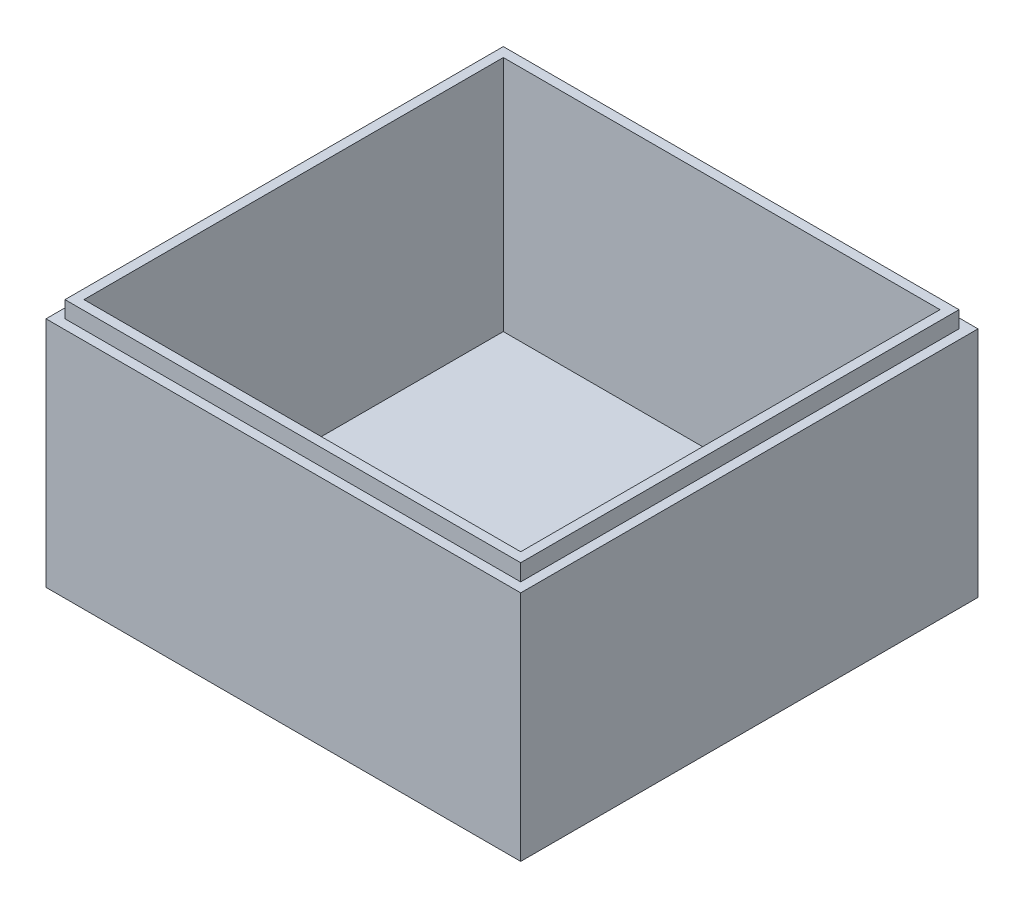
from build123d import *

# Parameters (mm, degrees)
BATTERYANDOUTERWALLS_W   = 60
BATTERYANDOUTERWALLS_H   = 57.8
BATTERYANDOUTERWALLS_W_2 = 55.2
BATTERYANDOUTERWALLS_H_2 = 53
WALLS_DEPTH              = 30
SKETCH2_W                = 60
SKETCH2_H                = 57.8
BOTTOM_DEPTH             = 1.5
SINKRIM_W                = 60
SINKRIM_H                = 57.8
SINKRIM_W_2              = 57.6
SINKRIM_H_2              = 55.4
TOP_CUT_DEPTH            = 2.1
BOSS_EXTRUDE2_DEPTH      = 60


with BuildPart() as part:
    # BatteryAndOuterWalls → Walls (new body)
    with BuildSketch(Plane(origin=(0, 0, 0), x_dir=(1, 0, 0), z_dir=(0, 1, 0))):
        Rectangle(BATTERYANDOUTERWALLS_W, BATTERYANDOUTERWALLS_H)
        Rectangle(BATTERYANDOUTERWALLS_W_2, BATTERYANDOUTERWALLS_H_2, mode=Mode.SUBTRACT)
    extrude(amount=WALLS_DEPTH)

    # Sketch2 → Bottom (add)
    with BuildSketch(Plane.XZ):
        Rectangle(SKETCH2_W, SKETCH2_H)
    extrude(amount=BOTTOM_DEPTH)

    # SinkRim → Top-Cut (cut)
    with BuildSketch(Plane(origin=(0, 30, 0), x_dir=(1, 0, 0), z_dir=(0, 1, 0))):
        Rectangle(SINKRIM_W, SINKRIM_H)
        Rectangle(SINKRIM_W_2, SINKRIM_H_2, mode=Mode.SUBTRACT)
    extrude(amount=-TOP_CUT_DEPTH, mode=Mode.SUBTRACT)

    # FrontRail → Boss-Extrude2 (add)
    with BuildSketch(Plane(origin=(30, 0, 0), x_dir=(0, 0, -1), z_dir=(1, 0, 0))):
        with BuildLine():
            Line((-23.5, 15), (-26.5, 15))
            Line((-26.5, 15), (-26.5, 13))
            ThreePointArc((-26.5, 13), (-25.292838828, 13.741380952), (-23.9, 14))
            ThreePointArc((-23.9, 14), (-23.617157288, 14.117157288), (-23.5, 14.4))
            Line((-23.5, 14.4), (-23.5, 15))
        make_face()
    extrude(amount=-BOSS_EXTRUDE2_DEPTH)


solid = part.part
